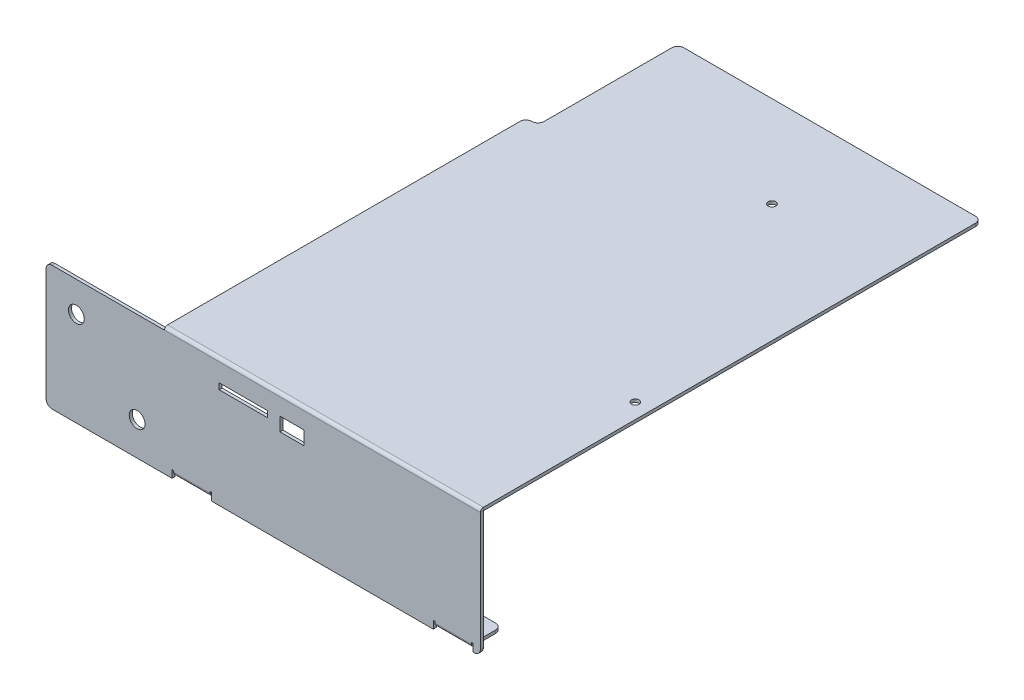
from build123d import *

# Parameters (mm, degrees)
BASE_FLANGE1_START       = -71.5
BASE_FLANGE1_DEPTH       = 143
SKETCH6_W                = 39
SKETCH6_H                = 165
CUT_EXTRUDE1_DEPTH       = 1
SKETCH7_W                = 4
SKETCH7_H                = 46
CUT_EXTRUDE2_DEPTH       = 10
SKETCH8_R                = 2.6
CUT_EXTRUDE3_DEPTH       = 1
SKETCH9_W                = 16
SKETCH9_H                = 2
SKETCH9_W_2              = 8
SKETCH9_H_2              = 4.5
CUT_EXTRUDE4_DEPTH       = 185.66523766
SKETCH10_R               = 1.25
CUT_EXTRUDE5_DEPTH       = 1
EDGE_FLANGE1_START       = 56
EDGE_FLANGE1_DEPTH       = 13
EDGE_FLANGE1_2_DEPTH     = 0.5
EDGE_FLANGE1_START_2     = 68.5
EDGE_FLANGE1_3_DEPTH     = 0.5
EDGE_FLANGE1_START_3     = 56.5
EDGE_FLANGE1_4_OUTLINE_W = 1
EDGE_FLANGE1_4_OUTLINE_H = 9
EDGE_FLANGE1_4_DEPTH     = 12
EDGE_FLANGE2_START       = -30
EDGE_FLANGE2_DEPTH       = 13
EDGE_FLANGE2_2_DEPTH     = 0.5
EDGE_FLANGE2_START_2     = -17.5
EDGE_FLANGE2_3_DEPTH     = 0.5
EDGE_FLANGE2_START_3     = -29.5
EDGE_FLANGE2_4_OUTLINE_W = 1
EDGE_FLANGE2_4_OUTLINE_H = 9
EDGE_FLANGE2_4_DEPTH     = 12
SKETCH17_R               = 1.25
CUT_EXTRUDE6_DEPTH       = 1
FILLET1_R                = 2


# Read off the part's stored shape, not the designer's step: Base-Flange1, Edge-Flange1, Edge-Flange2
with BuildPart() as part:
    # Base-Flange1 outline → Base-Flange1 (new body)
    with BuildSketch(Plane(origin=(0, 0, 0), x_dir=(0, 0, -1), z_dir=(1, 0, 0)).offset(BASE_FLANGE1_START)):
        with BuildLine():
            Line((1, -1), (165, -1))
            Line((165, -1), (165, 0))
            Line((165, 0), (1, 0))
            ThreePointArc((1, 0), (0.292893219, -0.292893219), (0, -1))
            Line((0, -1), (0, -42))
            Line((0, -42), (1, -42))
            Line((1, -42), (1, -1))
        make_face()
    extrude(amount=BASE_FLANGE1_DEPTH)

    # Sketch6 → Cut-Extrude1 (cut)
    with BuildSketch(Plane(origin=(0, 0, 0), x_dir=(1, 0, 0), z_dir=(0, 1, 0))):
        with Locations((-52, 82.5)):
            Rectangle(SKETCH6_W, SKETCH6_H)
    extrude(amount=-CUT_EXTRUDE1_DEPTH, mode=Mode.SUBTRACT)

    # Sketch7 → Cut-Extrude2 (cut)
    with BuildSketch(Plane(origin=(0, 0, 0), x_dir=(1, 0, 0), z_dir=(0, 1, 0))):
        with Locations((-30.5, 142)):
            Rectangle(SKETCH7_W, SKETCH7_H)
    extrude(amount=-CUT_EXTRUDE2_DEPTH, mode=Mode.SUBTRACT)

    # Sketch8 → Cut-Extrude3 (cut)
    with BuildSketch(Plane.XY):
        with Locations((-61.5, -11)):
            Circle(SKETCH8_R)
        with Locations((-41.5, -31)):
            Circle(SKETCH8_R)
    extrude(amount=-CUT_EXTRUDE3_DEPTH, mode=Mode.SUBTRACT)

    # Sketch9 → Cut-Extrude4 (cut, through all)
    with BuildSketch(Plane.XY):
        with Locations((-6.5, -8)):
            Rectangle(SKETCH9_W, SKETCH9_H)
        with Locations((9.5, -8.75)):
            Rectangle(SKETCH9_W_2, SKETCH9_H_2)
    extrude(amount=-CUT_EXTRUDE4_DEPTH, mode=Mode.SUBTRACT)

    # Sketch10 → Cut-Extrude5 (cut)
    with BuildSketch(Plane(origin=(0, 0, 0), x_dir=(1, 0, 0), z_dir=(0, 1, 0))):
        with Locations(Location((66.5, 56, 0), (0, 0, 270))):
            Circle(SKETCH10_R)
        with Locations(Location((32.5, 135, 0), (0, 0, 270))):
            Circle(SKETCH10_R)
    extrude(amount=-CUT_EXTRUDE5_DEPTH, mode=Mode.SUBTRACT)

    # Edge-Flange1 outline → Edge-Flange1 (cut)
    with BuildSketch(Plane.YZ.offset(EDGE_FLANGE1_START)):
        with BuildLine():
            ThreePointArc((-41, -1), (-40.707106781, -0.292893219), (-40, 0))
            Line((-40, 0), (-42, 0))
            Line((-42, 0), (-42, -1))
            Line((-42, -1), (-41, -1))
        make_face()
    extrude(amount=EDGE_FLANGE1_DEPTH, mode=Mode.SUBTRACT)

    # Edge-Flange1 2 outline → Edge-Flange1 2 (cut)
    with BuildSketch(Plane.YZ.offset(EDGE_FLANGE1_START)):
        with BuildLine():
            Line((-39.5, -1), (-39.5, 0))
            Line((-39.5, 0), (-40, 0))
            ThreePointArc((-40, 0), (-40.707106781, -0.292893219), (-41, -1))
            Line((-41, -1), (-39.5, -1))
        make_face()
    extrude(amount=EDGE_FLANGE1_2_DEPTH, mode=Mode.SUBTRACT)

    # Edge-Flange1 3 outline → Edge-Flange1 3 (cut)
    with BuildSketch(Plane.YZ.offset(EDGE_FLANGE1_START_2)):
        with BuildLine():
            Line((-39.5, -1), (-39.5, 0))
            Line((-39.5, 0), (-40, 0))
            ThreePointArc((-40, 0), (-40.707106781, -0.292893219), (-41, -1))
            Line((-41, -1), (-39.5, -1))
        make_face()
    extrude(amount=EDGE_FLANGE1_3_DEPTH, mode=Mode.SUBTRACT)

    # Edge-Flange1 4 outline → Edge-Flange1 4 (add)
    with BuildSketch(Plane.YZ.offset(EDGE_FLANGE1_START_3)):
        with Locations((-40.5, -5.5)):
            Rectangle(EDGE_FLANGE1_4_OUTLINE_W, EDGE_FLANGE1_4_OUTLINE_H)
    extrude(amount=EDGE_FLANGE1_4_DEPTH)

    # Edge-Flange2 outline → Edge-Flange2 (cut)
    with BuildSketch(Plane.YZ.offset(EDGE_FLANGE2_START)):
        with BuildLine():
            ThreePointArc((-41, -1), (-40.707106781, -0.292893219), (-40, 0))
            Line((-40, 0), (-42, 0))
            Line((-42, 0), (-42, -1))
            Line((-42, -1), (-41, -1))
        make_face()
    extrude(amount=EDGE_FLANGE2_DEPTH, mode=Mode.SUBTRACT)

    # Edge-Flange2 2 outline → Edge-Flange2 2 (cut)
    with BuildSketch(Plane.YZ.offset(EDGE_FLANGE2_START)):
        with BuildLine():
            Line((-39.5, -1), (-39.5, 0))
            Line((-39.5, 0), (-40, 0))
            ThreePointArc((-40, 0), (-40.707106781, -0.292893219), (-41, -1))
            Line((-41, -1), (-39.5, -1))
        make_face()
    extrude(amount=EDGE_FLANGE2_2_DEPTH, mode=Mode.SUBTRACT)

    # Edge-Flange2 3 outline → Edge-Flange2 3 (cut)
    with BuildSketch(Plane.YZ.offset(EDGE_FLANGE2_START_2)):
        with BuildLine():
            Line((-39.5, -1), (-39.5, 0))
            Line((-39.5, 0), (-40, 0))
            ThreePointArc((-40, 0), (-40.707106781, -0.292893219), (-41, -1))
            Line((-41, -1), (-39.5, -1))
        make_face()
    extrude(amount=EDGE_FLANGE2_3_DEPTH, mode=Mode.SUBTRACT)

    # Edge-Flange2 4 outline → Edge-Flange2 4 (add)
    with BuildSketch(Plane.YZ.offset(EDGE_FLANGE2_START_3)):
        with Locations((-40.5, -5.5)):
            Rectangle(EDGE_FLANGE2_4_OUTLINE_W, EDGE_FLANGE2_4_OUTLINE_H)
    extrude(amount=EDGE_FLANGE2_4_DEPTH)

    # Sketch17 → Cut-Extrude6 (cut)
    with BuildSketch(Plane.XZ.offset(41)):
        with Locations(Location((-23.5, -5, 0), (0, 0, 270))):
            Circle(SKETCH17_R)
        with Locations(Location((62.5, -5, 0), (0, 0, 270))):
            Circle(SKETCH17_R)
    extrude(amount=-CUT_EXTRUDE6_DEPTH, mode=Mode.SUBTRACT)

    # Fillet1
    fillet1_edges = [part.edges().sort_by_distance(p)[0] for p in [
        (71.5, -42, -0.5),
        (71.5, -0.5, -165),
        (-28.5, -0.5, -165),
        (-28.5, -0.5, -119),
        (-32.5, -0.5, -119),
        (-71.5, -42, -0.5),
        (-71.5, -1, -0.5),
        (-29.5, -40.5, -10),
        (-17.5, -40.5, -10),
        (56.5, -40.5, -10),
        (68.5, -40.5, -10),
    ]]
    fillet(fillet1_edges, radius=FILLET1_R - 0.0001)  # a hair under: the kernel refuses the full size


solid = part.part
